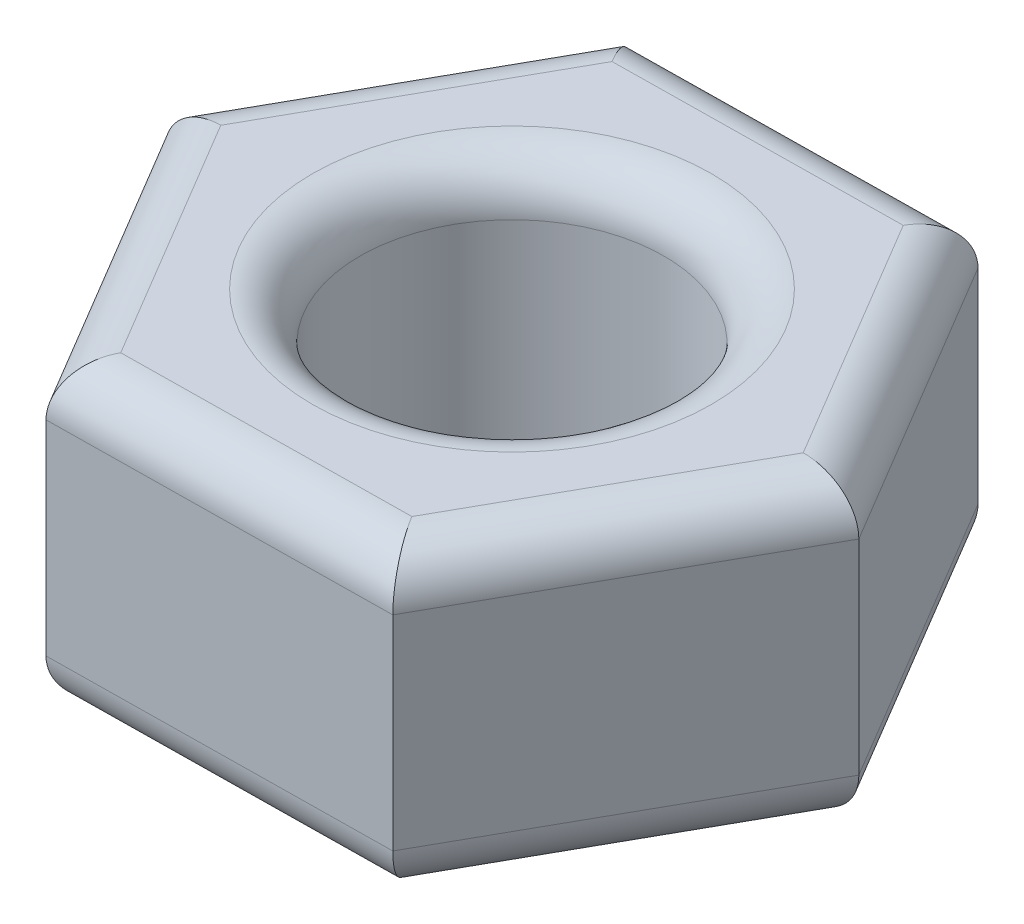
from build123d import *

# Parameters (mm, degrees)
SKETCH1_R           = 3.2
BOSS_EXTRUDE1_DEPTH = 6.3
FILLET1_R           = 1


with BuildPart() as part:
    # Sketch1 → Boss-Extrude1 (new body)
    with BuildSketch(Plane(origin=(0, 0, 0), x_dir=(1, 0, 0), z_dir=(0, 1, 0))):
        Polygon((-3.681439065, 6.187649506), (-7.199381195, -0.094395), (-3.517942129, -6.282044506), (3.681439065, -6.187649506), (7.199381195, 0.094395), (3.517942129, 6.282044506), align=None)
        Circle(SKETCH1_R, mode=Mode.SUBTRACT)
    extrude(amount=BOSS_EXTRUDE1_DEPTH)

    # Fillet1
    fillet1_edges = [part.edges().sort_by_distance(p)[0] for p in [
        (-3.2, 6.3, 0),
        (5.358661662, 6.3, -3.188219753),
        (5.44041013, 6.3, 3.046627253),
        (0.081748468, 6.3, 6.234847006),
        (-5.358661662, 6.3, 3.188219753),
        (-5.44041013, 6.3, -3.046627253),
        (-0.081748468, 6.3, -6.234847006),
        (-3.2, 0, 0),
        (-5.44041013, 0, -3.046627253),
        (-5.358661662, 0, 3.188219753),
        (0.081748468, 0, 6.234847006),
        (5.44041013, 0, 3.046627253),
        (5.358661662, 0, -3.188219753),
        (-0.081748468, 0, -6.234847006),
    ]]
    fillet(fillet1_edges, radius=FILLET1_R)


solid = part.part
